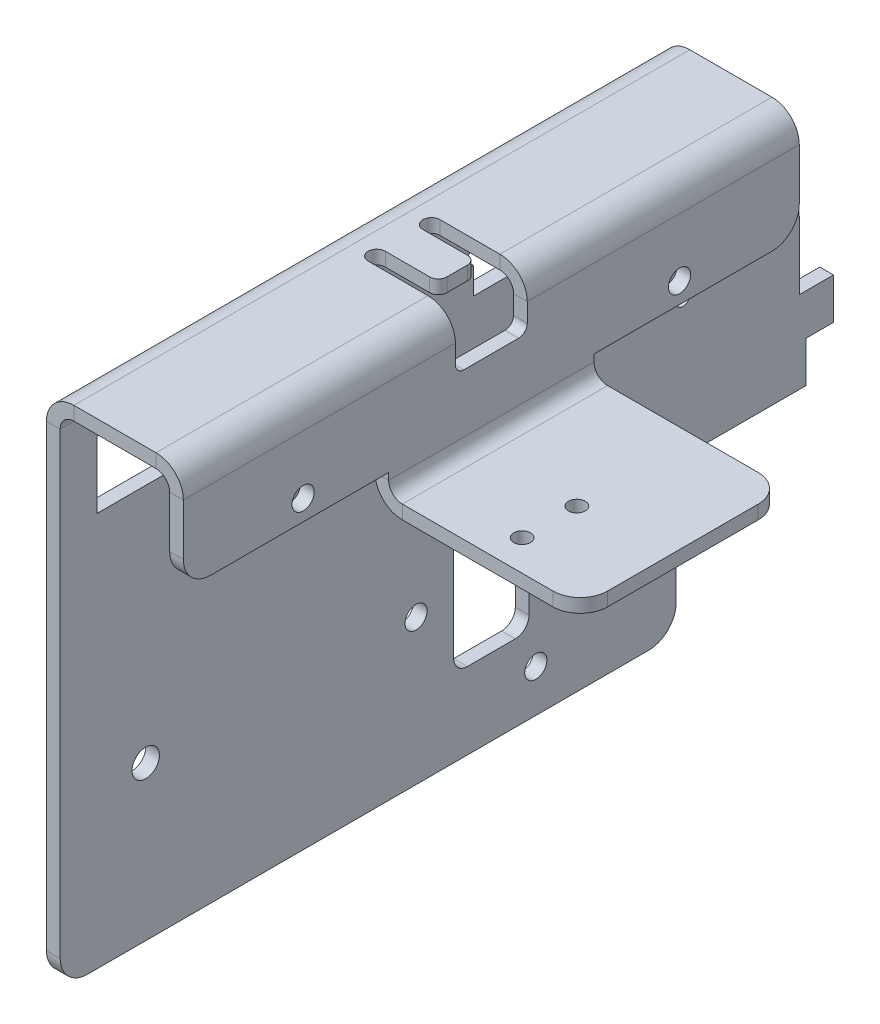
from build123d import *

# Parameters (mm, degrees)
BOSS_EXTRUDE1_DEPTH        = 2
F_4_0_4_DIAMETER_HOLE1_D   = 4
M3_CLEARANCE_HOLE1_D       = 3.242
M2_CLEARANCE_HOLE1_D       = 2.459
CUT_EXTRUDE1_DEPTH         = 120.410650844
CUT_EXTRUDE2_DEPTH         = 120.410650844
CUT_EXTRUDE3_DEPTH         = 120.410650844
SKETCHED_START             = 71.002297961
SKETCHED_BEND5_OUTLINE_W   = 2
SKETCHED_BEND5_OUTLINE_H   = 30
SKETCHED_BEND5_DEPTH       = 27.13486898
SKETCHED_START_2           = 69.424777961
SKETCHED_BEND5_2_OUTLINE_R = 1.2295
SKETCHED_BEND5_2_DEPTH     = 1.57752
SKETCHED_START_3           = 70.821415498
SKETCHED_BEND5_3_OUTLINE_W = 2
SKETCHED_BEND5_3_OUTLINE_H = 30
SKETCHED_BEND5_3_DEPTH     = 0.180882463
SKETCHED_START_4           = 67.424777961
SKETCHED_BEND5_4_OUTLINE_R = 1.2295
SKETCHED_BEND5_4_DEPTH     = 3.044520614
SKETCHED_BEND5_5_OUTLINE_R = 1.2295
SKETCHED_BEND5_5_DEPTH     = 0.42248
SKETCHED_START_5           = -15
SKETCHED_BEND5_6_DEPTH     = 30
SKETCHED_BEND5_7_DEPTH     = 30
SKETCHED_START_6           = 53.789908981
SKETCHED_BEND6_OUTLINE_R   = 1.2295
SKETCHED_BEND6_DEPTH       = 17.63486898
SKETCHED_START_7           = 50.212388981
SKETCHED_BEND6_2_OUTLINE_R = 1.621
SKETCHED_BEND6_2_DEPTH     = 5.796728131
SKETCHED_START_8           = 52.569466273
SKETCHED_BEND6_3_OUTLINE_W = 2
SKETCHED_BEND6_3_OUTLINE_H = 30
SKETCHED_BEND6_3_DEPTH     = 29.642922707
SKETCHED_BEND6_4_DEPTH     = 30
SKETCHED_START_9           = -45
SKETCHED_BEND6_5_DEPTH     = 90
SKETCHED_START_10          = 13
SKETCHED_BEND6_6_OUTLINE_W = 2
SKETCHED_BEND6_6_OUTLINE_H = 30
SKETCHED_BEND6_6_OUTLINE_R = 1.2295
SKETCHED_BEND6_6_DEPTH     = 5.5
SKETCHED_START_11          = 17.9863
SKETCHED_BEND6_7_OUTLINE_W = 1.642922708
SKETCHED_BEND6_7_OUTLINE_H = 30
SKETCHED_BEND6_7_DEPTH     = 0.5137
SKETCHED_BEND7_DEPTH       = 90
SKETCHED_BEND7_2_OUTLINE_W = 2
SKETCHED_BEND7_2_OUTLINE_H = 7.500000007
SKETCHED_BEND7_2_DEPTH     = 90
SKETCHED_BEND7_3_DEPTH     = 30
SKETCHED_BEND7_4_DEPTH     = 41
SKETCHED_START_12          = 4
SKETCHED_BEND7_5_DEPTH     = 41
SKETCHED_START_13          = 30.750000007
SKETCHED_BEND7_6_DEPTH     = 7.249999993
SKETCHED_START_14          = 4.5
SKETCHED_BEND7_7_OUTLINE_R = 1.2295
SKETCHED_BEND7_7_DEPTH     = 17.5
SKETCHED_START_15          = 16
SKETCHED_BEND7_8_OUTLINE_R = 1.621
SKETCHED_BEND7_8_DEPTH     = 3
SKETCHED_START_16          = 9.797769412
SKETCHED_BEND8_OUTLINE_W   = 2
SKETCHED_BEND8_OUTLINE_H   = 16.000000001
SKETCHED_BEND8_DEPTH       = 15.152820181
SKETCHED_START_17          = 8.369100306
SKETCHED_BEND8_2_OUTLINE_R = 1.2295
SKETCHED_BEND8_2_DEPTH     = 1.428669106
SKETCHED_START_18          = 6.746620306
SKETCHED_BEND8_3_OUTLINE_R = 1.2295
SKETCHED_BEND8_3_DEPTH     = 3.62248
SKETCHED_START_19          = -62.999999998
SKETCHED_BEND8_4_DEPTH     = 16
SKETCHED_BEND8_5_DEPTH     = 16


with BuildPart() as part:
    # Sketch17 → Boss-Extrude1 (new body)
    with BuildSketch(Plane(origin=(0, 0, 0), x_dir=(0, 0, -1), z_dir=(1, 0, 0))):
        with BuildLine():
            Line((-45, 62.424777961), (-45, -33.5))
            ThreePointArc((-45, -33.5), (-43.828427125, -36.328427125), (-41, -37.5))
            Line((-41, -37.5), (41, -37.5))
            ThreePointArc((41, -37.5), (43.828427125, -36.328427125), (45, -33.5))
            Line((45, -33.5), (45, -25.5))
            Line((45, -25.5), (41.000000004, -25.5))
            Line((41.000000004, -25.5), (41.000000004, -15.5))
            Line((41.000000004, -15.5), (63.999999999, -15.5))
            Line((63.999999999, -15.5), (63.999999999, -9.5))
            Line((63.999999999, -9.5), (67.999999998, -9.5))
            Line((67.999999998, -9.5), (67.999999998, -3.5))
            Line((67.999999998, -3.5), (62.999999998, -3.5))
            Line((62.999999998, -3.5), (62.999999998, 22.950589592))
            ThreePointArc((62.999999998, 22.950589592), (62.41421356, 24.364803155), (60.999999998, 24.950589593))
            Line((60.999999998, 24.950589593), (48.999999998, 24.950589593))
            ThreePointArc((48.999999998, 24.950589593), (47.585786435, 24.364803155), (46.999999998, 22.950589592))
            Line((46.999999998, 22.950589592), (46.999999998, 4.5))
            ThreePointArc((46.999999998, 4.5), (45.999999999, 3.500000002), (45, 4.5))
            Line((45, 4.5), (45, 62.424777961))
            ThreePointArc((45, 62.424777961), (43.828427125, 65.253205086), (41, 66.424777961))
            Line((41, 66.424777961), (15, 66.424777961))
            Line((15, 66.424777961), (15, 94.137166941))
            ThreePointArc((15, 94.137166941), (13.828427125, 96.965594066), (11, 98.137166941))
            Line((11, 98.137166941), (-11, 98.137166941))
            ThreePointArc((-11, 98.137166941), (-13.828427125, 96.965594066), (-15, 94.137166941))
            Line((-15, 94.137166941), (-15, 66.424777961))
            Line((-15, 66.424777961), (-41, 66.424777961))
            ThreePointArc((-41, 66.424777961), (-43.828427125, 65.253205086), (-45, 62.424777961))
        make_face()
    extrude(amount=-BOSS_EXTRUDE1_DEPTH)

    # Ø4.0 (4) Diameter Hole1 (through all)
    with Locations(Plane.ZY.offset(2)):
        with Locations((32.5, -15), (-32.5, -15)):
            Hole(F_4_0_4_DIAMETER_HOLE1_D / 2)

    # M3 Clearance Hole1 (through all)
    with Locations(Plane.ZY.offset(2)):
        with Locations((-7, -16.3), (-24.5, -31.3), (-24.5, -1.3), (-27.5, 63.424777961), (27.5, 63.424777961)):
            Hole(M3_CLEARANCE_HOLE1_D / 2)

    # M2 Clearance Hole1 (through all)
    with Locations(Plane.ZY.offset(2)):
        with Locations((-54.999999998, 20.950589593), (-54.999999998, 12.950589593), (2.5, 85.137166941), (10.5, 85.137166941)):
            Hole(M2_CLEARANCE_HOLE1_D / 2)

    # Sketch24 → Cut-Extrude1 (cut, through all)
    with BuildSketch(Plane.ZY.offset(2)):
        with BuildLine():
            Line((5.25, 41.462388992), (5.25, 57.674777954))
            ThreePointArc((5.25, 57.674777954), (4.883883476, 58.55866143), (4, 58.924777954))
            Line((4, 58.924777954), (-4, 58.924777954))
            ThreePointArc((-4, 58.924777954), (-4.883883476, 58.55866143), (-5.25, 57.674777954))
            Line((-5.25, 57.674777954), (-5.25, 41.462388992))
            ThreePointArc((-5.25, 41.462388992), (-4, 40.212388992), (-2.75, 41.462388992))
            Line((-2.75, 41.462388992), (-2.75, 47.962388992))
            ThreePointArc((-2.75, 47.962388992), (-2.383883476, 48.846272468), (-1.5, 49.212388992))
            Line((-1.5, 49.212388992), (1.5, 49.212388992))
            ThreePointArc((1.5, 49.212388992), (2.383883476, 48.846272468), (2.75, 47.962388992))
            Line((2.75, 47.962388992), (2.75, 41.462388992))
            ThreePointArc((2.75, 41.462388992), (4, 40.212388992), (5.25, 41.462388992))
        make_face()
    extrude(amount=-CUT_EXTRUDE1_DEPTH, mode=Mode.SUBTRACT)

    # Sketch25 → Cut-Extrude2 (cut, through all)
    with BuildSketch(Plane(origin=(0, 0, 0), x_dir=(0, 0, -1), z_dir=(1, 0, 0))):
        with BuildLine():
            Line((-15.4, 20.125576935), (-15.4, 23.999999992))
            ThreePointArc((-15.4, 23.999999992), (-14.4, 24.999999992), (-15.4, 25.999999992))
            Line((-15.4, 25.999999992), (-15.4, 29.87442305))
            Line((-15.4, 29.87442305), (-39.6, 29.87442305))
            Line((-39.6, 29.87442305), (-39.6, 20.125576935))
            Line((-39.6, 20.125576935), (-15.4, 20.125576935))
        make_face()
        with BuildLine():
            Line((39.6, 29.87442305), (39.6, 20.125576935))
            Line((39.6, 20.125576935), (15.4, 20.125576935))
            Line((15.4, 20.125576935), (15.4, 23.999999992))
            ThreePointArc((15.4, 23.999999992), (14.4, 24.999999992), (15.4, 25.999999992))
            Line((15.4, 25.999999992), (15.4, 29.87442305))
            Line((15.4, 29.87442305), (39.6, 29.87442305))
        make_face()
    extrude(amount=-CUT_EXTRUDE2_DEPTH, mode=Mode.SUBTRACT)

    # Sketch26 → Cut-Extrude3 (cut, through all)
    with BuildSketch(Plane.ZY.offset(2)):
        with BuildLine():
            Line((-21.500000002, -26.3), (-14.499999998, -26.3))
            ThreePointArc((-14.499999998, -26.3), (-13.085786437, -25.714213563), (-12.5, -24.300000002))
            Line((-12.5, -24.300000002), (-12.5, -8.299999998))
            ThreePointArc((-12.5, -8.299999998), (-13.085786437, -6.885786437), (-14.499999998, -6.3))
            Line((-14.499999998, -6.3), (-21.500000002, -6.3))
            ThreePointArc((-21.500000002, -6.3), (-22.914213563, -6.885786437), (-23.5, -8.299999998))
            Line((-23.5, -8.299999998), (-23.5, -24.300000002))
            ThreePointArc((-23.5, -24.300000002), (-22.914213563, -25.714213563), (-21.500000002, -26.3))
        make_face()
    extrude(amount=-CUT_EXTRUDE3_DEPTH, mode=Mode.SUBTRACT)

    # Sketched Bend5: read off the stored shape, not the designer's step
    # Sketched Bend5 outline → Sketched Bend5 (cut)
    with BuildSketch(Plane(origin=(0, 0, 0), x_dir=(1, 0, 0), z_dir=(0, 1, 0)).offset(SKETCHED_START)):
        with Locations((-1, 0)):
            Rectangle(SKETCHED_BEND5_OUTLINE_W, SKETCHED_BEND5_OUTLINE_H)
    extrude(amount=SKETCHED_BEND5_DEPTH, mode=Mode.SUBTRACT)

    # Sketched Bend5 2 outline → Sketched Bend5 2 (add)
    with BuildSketch(Plane(origin=(0, 0, 0), x_dir=(1, 0, 0), z_dir=(0, 1, 0)).offset(SKETCHED_START_2)):
        with BuildLine():
            ThreePointArc((-30, -11), (-28.828427125, -13.828427125), (-26, -15))
            Line((-26, -15), (-2, -15))
            Line((-2, -15), (-2, 15))
            Line((-2, 15), (-26, 15))
            ThreePointArc((-26, 15), (-28.828427125, 13.828427125), (-30, 11))
            Line((-30, 11), (-30, -11))
        make_face()
        with Locations((-17, -10.5)):
            Circle(SKETCHED_BEND5_2_OUTLINE_R, mode=Mode.SUBTRACT)
        with Locations((-17, -2.5)):
            Circle(SKETCHED_BEND5_2_OUTLINE_R, mode=Mode.SUBTRACT)
    extrude(amount=SKETCHED_BEND5_2_DEPTH)

    # Sketched Bend5 3 outline → Sketched Bend5 3 (cut)
    with BuildSketch(Plane(origin=(0, 0, 0), x_dir=(1, 0, 0), z_dir=(0, 1, 0)).offset(SKETCHED_START_3)):
        with Locations((-1, 0)):
            Rectangle(SKETCHED_BEND5_3_OUTLINE_W, SKETCHED_BEND5_3_OUTLINE_H)
    extrude(amount=SKETCHED_BEND5_3_DEPTH, mode=Mode.SUBTRACT)

    # Sketched Bend5 4 outline → Sketched Bend5 4 (add)
    with BuildSketch(Plane(origin=(0, 0, 0), x_dir=(1, 0, 0), z_dir=(0, 1, 0)).offset(SKETCHED_START_4)):
        with BuildLine():
            ThreePointArc((-30, -11), (-28.828427125, -13.828427125), (-26, -15))
            Line((-26, -15), (-2, -15))
            Line((-2, -15), (-2, 15))
            Line((-2, 15), (-26, 15))
            ThreePointArc((-26, 15), (-28.828427125, 13.828427125), (-30, 11))
            Line((-30, 11), (-30, -11))
        make_face()
        with Locations((-17, -10.5)):
            Circle(SKETCHED_BEND5_4_OUTLINE_R, mode=Mode.SUBTRACT)
        with Locations((-17, -2.5)):
            Circle(SKETCHED_BEND5_4_OUTLINE_R, mode=Mode.SUBTRACT)
    extrude(amount=SKETCHED_BEND5_4_DEPTH)

    # Sketched Bend5 5 outline → Sketched Bend5 5 (add)
    with BuildSketch(Plane(origin=(0, 0, 0), x_dir=(1, 0, 0), z_dir=(0, 1, 0)).offset(SKETCHED_START)):
        with BuildLine():
            ThreePointArc((-30, -11), (-28.828427125, -13.828427125), (-26, -15))
            Line((-26, -15), (-2, -15))
            Line((-2, -15), (-2, 15))
            Line((-2, 15), (-26, 15))
            ThreePointArc((-26, 15), (-28.828427125, 13.828427125), (-30, 11))
            Line((-30, 11), (-30, -11))
        make_face()
        with Locations((-17, -10.5)):
            Circle(SKETCHED_BEND5_5_OUTLINE_R, mode=Mode.SUBTRACT)
        with Locations((-17, -2.5)):
            Circle(SKETCHED_BEND5_5_OUTLINE_R, mode=Mode.SUBTRACT)
    extrude(amount=SKETCHED_BEND5_5_DEPTH)

    # Sketched Bend5 6 outline → Sketched Bend5 6 (cut)
    with BuildSketch(Plane.XY.offset(SKETCHED_START_5)):
        with BuildLine():
            ThreePointArc((-2, 67.424777961), (-2.585786438, 68.838991523), (-4, 69.424777961))
            Line((-4, 69.424777961), (-30, 69.424777961))
            Line((-30, 69.424777961), (-30, 67.424777961))
            Line((-30, 67.424777961), (-2, 67.424777961))
        make_face()
        with BuildLine():
            Line((0, 70.821415498), (-1.887453327, 70.821415498))
            ThreePointArc((-1.887453327, 70.821415498), (-0.503559904, 69.367689862), (0, 67.424777961))
            Line((0, 67.424777961), (0, 70.821415498))
        make_face()
        with BuildLine():
            Line((-2, 71.424777961), (-4, 71.424777961))
            ThreePointArc((-4, 71.424777961), (-2.96472382, 71.288481266), (-2, 70.888879577))
            Line((-2, 70.888879577), (-2, 71.424777961))
        make_face()
    extrude(amount=SKETCHED_BEND5_6_DEPTH, mode=Mode.SUBTRACT)

    # Sketched Bend5 7 outline → Sketched Bend5 7 (add)
    with BuildSketch(Plane.XY.offset(SKETCHED_START_5)):
        with BuildLine():
            ThreePointArc((-1.887453327, 70.821415498), (-1.943450004, 70.855609073), (-2, 70.888879577))
            Line((-2, 70.888879577), (-2, 70.821415498))
            Line((-2, 70.821415498), (-1.887453327, 70.821415498))
        make_face()
    extrude(amount=SKETCHED_BEND5_7_DEPTH)

    # Sketched Bend6: read off the stored shape, not the designer's step
    # Sketched Bend6 outline → Sketched Bend6 (cut)
    with BuildSketch(Plane(origin=(0, 0, 0), x_dir=(1, 0, 0), z_dir=(0, 1, 0)).offset(SKETCHED_START_6)):
        with BuildLine():
            Line((0, 45), (-2, 45))
            Line((-2, 45), (-2, 15))
            Line((-2, 15), (-26, 15))
            ThreePointArc((-26, 15), (-28.828427125, 13.828427125), (-30, 11))
            Line((-30, 11), (-30, -11))
            ThreePointArc((-30, -11), (-28.828427125, -13.828427125), (-26, -15))
            Line((-26, -15), (-2, -15))
            Line((-2, -15), (-2, -45))
            Line((-2, -45), (0, -45))
            Line((0, -45), (0, 45))
        make_face()
        with Locations((-17, -2.5)):
            Circle(SKETCHED_BEND6_OUTLINE_R, mode=Mode.SUBTRACT)
        with Locations((-17, -10.5)):
            Circle(SKETCHED_BEND6_OUTLINE_R, mode=Mode.SUBTRACT)
    extrude(amount=SKETCHED_BEND6_DEPTH, mode=Mode.SUBTRACT)

    # Sketched Bend6 2 outline → Sketched Bend6 2 (add)
    with BuildSketch(Plane(origin=(0, 0, 0), x_dir=(1, 0, 0), z_dir=(0, 1, 0)).offset(SKETCHED_START_7)):
        with BuildLine():
            ThreePointArc((13.5, 41), (12.328427125, 43.828427125), (9.5, 45))
            Line((9.5, 45), (0, 45))
            Line((0, 45), (0, 5.25))
            Line((0, 5.25), (4.749999993, 5.25))
            ThreePointArc((4.749999993, 5.25), (5.633883469, 4.883883476), (5.999999993, 4))
            Line((5.999999993, 4), (5.999999993, -4))
            ThreePointArc((5.999999993, -4), (5.633883469, -4.883883476), (4.749999993, -5.25))
            Line((4.749999993, -5.25), (0, -5.25))
            Line((0, -5.25), (0, -45))
            Line((0, -45), (9.5, -45))
            ThreePointArc((9.5, -45), (12.328427125, -43.828427125), (13.5, -41))
            Line((13.5, -41), (13.5, -15))
            Line((13.5, -15), (16.5, -15))
            Line((16.5, -15), (16.5, 15))
            Line((16.5, 15), (13.5, 15))
            Line((13.5, 15), (13.5, 41))
        make_face()
        with Locations((10.5, -27.5)):
            Circle(SKETCHED_BEND6_2_OUTLINE_R, mode=Mode.SUBTRACT)
        with Locations((10.5, 27.5)):
            Circle(SKETCHED_BEND6_2_OUTLINE_R, mode=Mode.SUBTRACT)
    extrude(amount=SKETCHED_BEND6_2_DEPTH)

    # Sketched Bend6 3 outline → Sketched Bend6 3 (add)
    with BuildSketch(Plane(origin=(0, 0, 0), x_dir=(1, 0, 0), z_dir=(0, 1, 0)).offset(SKETCHED_START_8)):
        with Locations((17.5, 0)):
            Rectangle(SKETCHED_BEND6_3_OUTLINE_W, SKETCHED_BEND6_3_OUTLINE_H)
    extrude(amount=SKETCHED_BEND6_3_DEPTH)

    # Sketched Bend6 4 outline → Sketched Bend6 4 (add)
    with BuildSketch(Plane.XY.offset(SKETCHED_START_5)):
        with BuildLine():
            ThreePointArc((16.5, 56.212388981), (16.497409152, 56.110621214), (16.489643322, 56.009117112))
            Line((16.489643322, 56.009117112), (16.5, 56.009117112))
            Line((16.5, 56.009117112), (16.5, 56.212388981))
        make_face()
    extrude(amount=SKETCHED_BEND6_4_DEPTH)

    # Sketched Bend6 5 outline → Sketched Bend6 5 (cut)
    with BuildSketch(Plane.XY.offset(SKETCHED_START_9)):
        with BuildLine():
            ThreePointArc((2, 52.212388981), (0.585786438, 51.626602543), (0, 50.212388981))
            Line((0, 50.212388981), (16.5, 50.212388981))
            Line((16.5, 50.212388981), (16.5, 52.569466273))
            Line((16.5, 52.569466273), (18.5, 52.569466273))
            Line((18.5, 52.569466273), (18.5, 56.212388981))
            ThreePointArc((18.5, 56.212388981), (17.328427125, 53.383961856), (14.5, 52.212388981))
            Line((14.5, 52.212388981), (2, 52.212388981))
        make_face()
        with BuildLine():
            Line((0, 56.009117112), (0, 53.789908981))
            Line((0, 53.789908981), (-2, 53.789908981))
            Line((-2, 53.789908981), (-2, 50.212388981))
            ThreePointArc((-2, 50.212388981), (-0.828427124, 53.040816105), (2, 54.212388981))
            Line((2, 54.212388981), (14.5, 54.212388981))
            ThreePointArc((14.5, 54.212388981), (15.840420879, 54.728046746), (16.489643322, 56.009117112))
            Line((16.489643322, 56.009117112), (0, 56.009117112))
        make_face()
    extrude(amount=SKETCHED_BEND6_5_DEPTH, mode=Mode.SUBTRACT)

    # Sketched Bend6 6 outline → Sketched Bend6 6 (cut)
    with BuildSketch(Plane.YZ.offset(SKETCHED_START_10)):
        with BuildLine():
            ThreePointArc((78.21238898, 15), (81.040816105, 13.828427125), (82.21238898, 11))
            Line((82.21238898, 11), (82.21238898, 15))
            Line((82.21238898, 15), (78.21238898, 15))
        make_face()
        with BuildLine():
            Line((82.21238898, -15), (82.21238898, -11))
            ThreePointArc((82.21238898, -11), (81.040816105, -13.828427125), (78.21238898, -15))
            Line((78.21238898, -15), (82.21238898, -15))
        make_face()
        with Locations((51.212388981, 0)):
            Rectangle(SKETCHED_BEND6_6_OUTLINE_W, SKETCHED_BEND6_6_OUTLINE_H)
        with Locations((69.21238898, 10.5)):
            Circle(SKETCHED_BEND6_6_OUTLINE_R)
        with Locations((69.21238898, 2.5)):
            Circle(SKETCHED_BEND6_6_OUTLINE_R)
    extrude(amount=SKETCHED_BEND6_6_DEPTH, mode=Mode.SUBTRACT)

    # Sketched Bend6 7 outline → Sketched Bend6 7 (cut)
    with BuildSketch(Plane.YZ.offset(SKETCHED_START_11)):
        with Locations((53.390927627, 0)):
            Rectangle(SKETCHED_BEND6_7_OUTLINE_W, SKETCHED_BEND6_7_OUTLINE_H)
    extrude(amount=SKETCHED_BEND6_7_DEPTH, mode=Mode.SUBTRACT)

    # Sketched Bend7: read off the stored shape, not the designer's step
    # Sketched Bend7 outline → Sketched Bend7 (cut)
    with BuildSketch(Plane.XY.offset(SKETCHED_START_9)):
        with BuildLine():
            ThreePointArc((-2, 33.5), (-1.464101615, 35.5), (0, 36.964101616))
            Line((0, 36.964101616), (0, 50.212388981))
            ThreePointArc((0, 50.212388981), (0.585786438, 51.626602543), (2, 52.212388981))
            Line((2, 52.212388981), (14.5, 52.212388981))
            ThreePointArc((14.5, 52.212388981), (17.328427125, 53.383961856), (18.5, 56.212388981))
            Line((18.5, 56.212388981), (18.5, 82.21238898))
            Line((18.5, 82.21238898), (16.5, 82.21238898))
            Line((16.5, 82.21238898), (16.5, 56.212388981))
            ThreePointArc((16.5, 56.212388981), (15.914213563, 54.798175418), (14.5, 54.212388981))
            Line((14.5, 54.212388981), (2, 54.212388981))
            ThreePointArc((2, 54.212388981), (-0.828427124, 53.040816105), (-2, 50.212388981))
            Line((-2, 50.212388981), (-2, 33.5))
        make_face()
    extrude(amount=SKETCHED_BEND7_DEPTH, mode=Mode.SUBTRACT)

    # Sketched Bend7 2 outline → Sketched Bend7 2 (add)
    with BuildSketch(Plane.XY.offset(SKETCHED_START_9)):
        with BuildLine():
            ThreePointArc((0, 33.5), (0.585786438, 34.914213562), (2, 35.5))
            Line((2, 35.5), (13.000000011, 35.5))
            Line((13.000000011, 35.5), (13.000000011, 37.5))
            Line((13.000000011, 37.5), (2, 37.5))
            ThreePointArc((2, 37.5), (0.96472382, 37.363703305), (0, 36.964101616))
            Line((0, 36.964101616), (0, 33.5))
        make_face()
        with Locations((17, 25.750000003)):
            Rectangle(SKETCHED_BEND7_2_OUTLINE_W, SKETCHED_BEND7_2_OUTLINE_H)
    extrude(amount=SKETCHED_BEND7_2_DEPTH)

    # Sketched Bend7 3 outline → Sketched Bend7 3 (add)
    with BuildSketch(Plane.XY.offset(SKETCHED_START_5)):
        with BuildLine():
            Line((18, 22), (16, 22))
            Line((16, 22), (16, 21))
            ThreePointArc((16, 21), (17.171572875, 18.171572875), (20, 17))
            Line((20, 17), (46, 17))
            Line((46, 17), (46, 19))
            Line((46, 19), (20, 19))
            ThreePointArc((20, 19), (18.585786438, 19.585786437), (18, 21))
            Line((18, 21), (18, 22))
        make_face()
    extrude(amount=SKETCHED_BEND7_3_DEPTH)

    # Sketched Bend7 4 outline → Sketched Bend7 4 (add)
    with BuildSketch(Plane.XY.offset(SKETCHED_START_9)):
        with BuildLine():
            Line((13.000000011, 37.5), (13.000000011, 35.5))
            Line((13.000000011, 35.5), (14, 35.5))
            ThreePointArc((14, 35.5), (15.414213563, 34.914213563), (16, 33.5))
            Line((16, 33.5), (16, 29.500000007))
            Line((16, 29.500000007), (18, 29.500000007))
            Line((18, 29.500000007), (18, 33.5))
            ThreePointArc((18, 33.5), (16.828427125, 36.328427125), (14, 37.5))
            Line((14, 37.5), (13.000000011, 37.5))
        make_face()
    extrude(amount=SKETCHED_BEND7_4_DEPTH)

    # Sketched Bend7 5 outline → Sketched Bend7 5 (add)
    with BuildSketch(Plane.XY.offset(SKETCHED_START_12)):
        with BuildLine():
            Line((13.000000011, 37.5), (13.000000011, 35.5))
            Line((13.000000011, 35.5), (14, 35.5))
            ThreePointArc((14, 35.5), (15.414213563, 34.914213563), (16, 33.5))
            Line((16, 33.5), (16, 29.500000007))
            Line((16, 29.500000007), (18, 29.500000007))
            Line((18, 29.500000007), (18, 33.5))
            ThreePointArc((18, 33.5), (16.828427125, 36.328427125), (14, 37.5))
            Line((14, 37.5), (13.000000011, 37.5))
        make_face()
    extrude(amount=SKETCHED_BEND7_5_DEPTH)

    # Sketched Bend7 6 outline → Sketched Bend7 6 (cut)
    with BuildSketch(Plane(origin=(0, 0, 0), x_dir=(1, 0, 0), z_dir=(0, 1, 0)).offset(SKETCHED_START_13)):
        with BuildLine():
            Line((18, -5.25), (18, -4))
            Line((18, -4), (13.000000011, -4))
            Line((13.000000011, -4), (13.000000011, -1.5))
            ThreePointArc((13.000000011, -1.5), (12.633883488, -2.383883477), (11.750000011, -2.75))
            Line((11.750000011, -2.75), (5.250000011, -2.75))
            ThreePointArc((5.250000011, -2.75), (4.000000011, -4), (5.250000011, -5.25))
            Line((5.250000011, -5.25), (18, -5.25))
        make_face()
        with BuildLine():
            Line((18, 4), (18, 5.25))
            Line((18, 5.25), (5.250000011, 5.25))
            ThreePointArc((5.250000011, 5.25), (4.000000011, 4), (5.250000011, 2.75))
            Line((5.250000011, 2.75), (11.750000011, 2.75))
            ThreePointArc((11.750000011, 2.75), (12.633883488, 2.383883477), (13.000000011, 1.5))
            Line((13.000000011, 1.5), (13.000000011, 4))
            Line((13.000000011, 4), (18, 4))
        make_face()
    extrude(amount=SKETCHED_BEND7_6_DEPTH, mode=Mode.SUBTRACT)

    # Sketched Bend7 7 outline → Sketched Bend7 7 (cut)
    with BuildSketch(Plane(origin=(0, 0, 0), x_dir=(1, 0, 0), z_dir=(0, 1, 0)).offset(SKETCHED_START_14)):
        with BuildLine():
            Line((46, -15), (46, -11))
            ThreePointArc((46, -11), (44.828427125, -13.828427125), (42, -15))
            Line((42, -15), (46, -15))
        make_face()
        with BuildLine():
            ThreePointArc((42, 15), (44.828427125, 13.828427125), (46, 11))
            Line((46, 11), (46, 15))
            Line((46, 15), (42, 15))
        make_face()
        with Locations((33, -10.5)):
            Circle(SKETCHED_BEND7_7_OUTLINE_R)
        with Locations((33, -2.5)):
            Circle(SKETCHED_BEND7_7_OUTLINE_R)
    extrude(amount=SKETCHED_BEND7_7_DEPTH, mode=Mode.SUBTRACT)

    # Sketched Bend7 8 outline → Sketched Bend7 8 (cut)
    with BuildSketch(Plane.YZ.offset(SKETCHED_START_15)):
        with BuildLine():
            Line((22, -45), (26, -45))
            ThreePointArc((26, -45), (23.171572875, -43.828427125), (22, -41))
            Line((22, -41), (22, -45))
        make_face()
        with BuildLine():
            Line((22, 45), (22, 41))
            ThreePointArc((22, 41), (23.171572875, 43.828427125), (26, 45))
            Line((26, 45), (22, 45))
        make_face()
        with BuildLine():
            Line((30.750000007, -4), (29.500000007, -4))
            ThreePointArc((29.500000007, -4), (29.866116531, -4.883883476), (30.750000007, -5.25))
            Line((30.750000007, -5.25), (30.750000007, -4))
        make_face()
        with BuildLine():
            Line((30.750000007, 4), (30.750000007, 5.25))
            ThreePointArc((30.750000007, 5.25), (29.866116531, 4.883883476), (29.500000007, 4))
            Line((29.500000007, 4), (30.750000007, 4))
        make_face()
        with Locations((25, 27.5)):
            Circle(SKETCHED_BEND7_8_OUTLINE_R)
        with Locations((25, -27.5)):
            Circle(SKETCHED_BEND7_8_OUTLINE_R)
    extrude(amount=SKETCHED_BEND7_8_DEPTH, mode=Mode.SUBTRACT)

    # Sketched Bend8: read off the stored shape, not the designer's step
    # Sketched Bend8 outline → Sketched Bend8 (cut)
    with BuildSketch(Plane(origin=(0, 0, 0), x_dir=(1, 0, 0), z_dir=(0, 1, 0)).offset(SKETCHED_START_16)):
        with Locations((-1, 54.999999998)):
            Rectangle(SKETCHED_BEND8_OUTLINE_W, SKETCHED_BEND8_OUTLINE_H)
    extrude(amount=SKETCHED_BEND8_DEPTH, mode=Mode.SUBTRACT)

    # Sketched Bend8 2 outline → Sketched Bend8 2 (add)
    with BuildSketch(Plane(origin=(0, 0, 0), x_dir=(1, 0, 0), z_dir=(0, 1, 0)).offset(SKETCHED_START_17)):
        with BuildLine():
            Line((-15.869100306, 46.999999998), (-2, 46.999999997))
            Line((-2, 46.999999997), (-2, 62.999999998))
            Line((-2, 62.999999998), (-15.869100306, 62.999999998))
            ThreePointArc((-15.869100306, 62.999999998), (-17.283313869, 62.414213561), (-17.869100306, 60.999999998))
            Line((-17.869100306, 60.999999998), (-17.869100306, 48.999999998))
            ThreePointArc((-17.869100306, 48.999999998), (-17.283313869, 47.585786435), (-15.869100306, 46.999999998))
        make_face()
        with Locations((-13.869100306, 54.999999998)):
            Circle(SKETCHED_BEND8_2_OUTLINE_R, mode=Mode.SUBTRACT)
        with Locations((-5.869100306, 54.999999998)):
            Circle(SKETCHED_BEND8_2_OUTLINE_R, mode=Mode.SUBTRACT)
    extrude(amount=SKETCHED_BEND8_2_DEPTH)

    # Sketched Bend8 3 outline → Sketched Bend8 3 (add)
    with BuildSketch(Plane(origin=(0, 0, 0), x_dir=(1, 0, 0), z_dir=(0, 1, 0)).offset(SKETCHED_START_18)):
        with BuildLine():
            Line((-15.869100306, 46.999999998), (-2, 46.999999997))
            Line((-2, 46.999999997), (-2, 62.999999998))
            Line((-2, 62.999999998), (-15.869100306, 62.999999998))
            ThreePointArc((-15.869100306, 62.999999998), (-17.283313869, 62.414213561), (-17.869100306, 60.999999998))
            Line((-17.869100306, 60.999999998), (-17.869100306, 48.999999998))
            ThreePointArc((-17.869100306, 48.999999998), (-17.283313869, 47.585786435), (-15.869100306, 46.999999998))
        make_face()
        with Locations((-13.869100306, 54.999999998)):
            Circle(SKETCHED_BEND8_3_OUTLINE_R, mode=Mode.SUBTRACT)
        with Locations((-5.869100306, 54.999999998)):
            Circle(SKETCHED_BEND8_3_OUTLINE_R, mode=Mode.SUBTRACT)
    extrude(amount=SKETCHED_BEND8_3_DEPTH)

    # Sketched Bend8 4 outline → Sketched Bend8 4 (cut)
    with BuildSketch(Plane.XY.offset(SKETCHED_START_19)):
        with BuildLine():
            ThreePointArc((-1.939847539, 9.797769412), (-0.51857717, 8.338794465), (0, 6.369100306))
            Line((0, 6.369100306), (0, 9.797769412))
            Line((0, 9.797769412), (-1.939847539, 9.797769412))
        make_face()
        with BuildLine():
            ThreePointArc((-4, 10.369100306), (-2.96472382, 10.232803611), (-2, 9.833201922))
            Line((-2, 9.833201922), (-2, 10.369100306))
            Line((-2, 10.369100306), (-4, 10.369100306))
        make_face()
        with BuildLine():
            Line((-17.869100306, 6.746620306), (-2.035953501, 6.746620306))
            ThreePointArc((-2.035953501, 6.746620306), (-2.726233931, 7.911021186), (-4, 8.369100306))
            Line((-4, 8.369100306), (-17.869100306, 8.369100306))
            Line((-17.869100306, 8.369100306), (-17.869100306, 6.746620306))
        make_face()
    extrude(amount=SKETCHED_BEND8_4_DEPTH, mode=Mode.SUBTRACT)

    # Sketched Bend8 5 outline → Sketched Bend8 5 (add)
    with BuildSketch(Plane.XY.offset(SKETCHED_START_19)):
        with BuildLine():
            Line((-2, 9.797769412), (-1.939847539, 9.797769412))
            ThreePointArc((-1.939847539, 9.797769412), (-1.969846467, 9.8156169), (-2, 9.833201922))
            Line((-2, 9.833201922), (-2, 9.797769412))
        make_face()
        with BuildLine():
            Line((-2, 6.369100306), (-2, 6.746620306))
            Line((-2, 6.746620306), (-2.035953501, 6.746620306))
            ThreePointArc((-2.035953501, 6.746620306), (-2.009008664, 6.558714391), (-2, 6.369100306))
        make_face()
    extrude(amount=SKETCHED_BEND8_5_DEPTH)


solid = part.part
